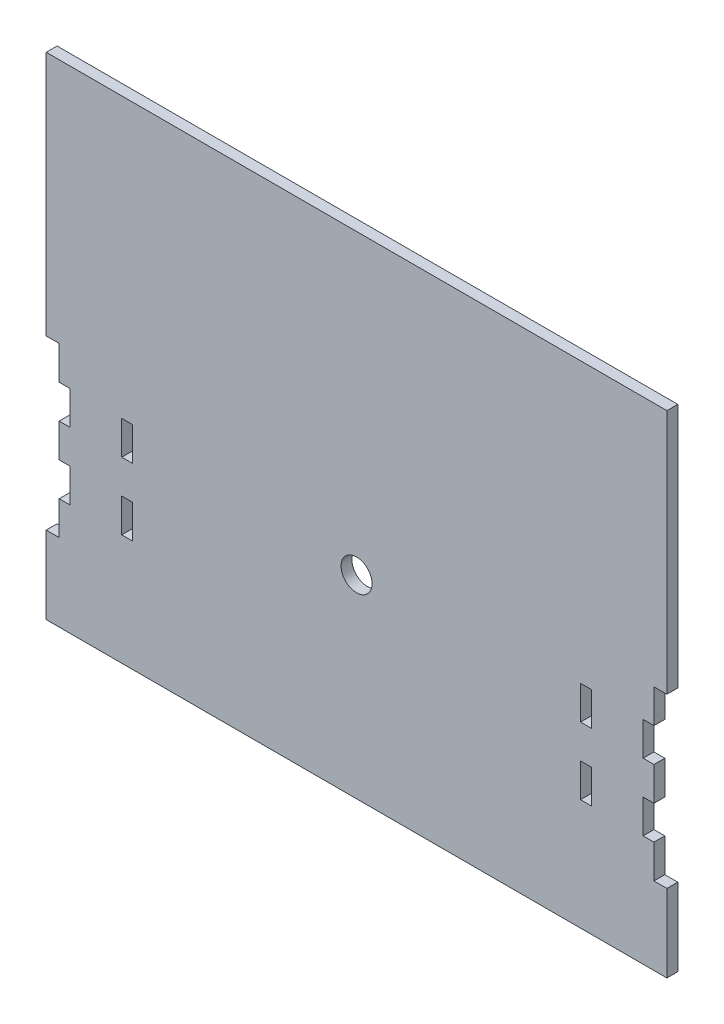
from build123d import *

# Parameters (mm, degrees)
SKETCH1_W           = 304.8
SKETCH1_H           = 241.3
BOSS_EXTRUDE1_DEPTH = 5.334
SKETCH2_W           = 6.35
SKETCH2_H           = 82.55
CUT_EXTRUDE1_DEPTH  = 195.44956687
SKETCH9_W           = 5.334
SKETCH9_H           = 16.51
CUT_EXTRUDE2_DEPTH  = 195.44956687
SKETCH23_W          = 5.334
SKETCH23_H          = 16.51
CUT_EXTRUDE8_DEPTH  = 195.44956687
SKETCH24_R          = 7.62
CUT_EXTRUDE9_DEPTH  = 195.44956687


with BuildPart() as part:
    # Sketch1 → Boss-Extrude1 (new body)
    with BuildSketch(Plane.XY):
        Rectangle(SKETCH1_W, SKETCH1_H)
    extrude(amount=BOSS_EXTRUDE1_DEPTH)

    # Sketch2 → Cut-Extrude1 (cut, through all)
    with BuildSketch(Plane(origin=(0, 0, 0), x_dir=(-1, 0, 0), z_dir=(0, 0, -1))):
        with Locations((149.225, -41.275)):
            Rectangle(SKETCH2_W, SKETCH2_H)
        with Locations((-149.225, -41.275)):
            Rectangle(SKETCH2_W, SKETCH2_H)
    extrude(amount=-CUT_EXTRUDE1_DEPTH, mode=Mode.SUBTRACT)

    # Sketch9 → Cut-Extrude2 (cut, through all)
    with BuildSketch(Plane.XY.offset(5.334)):
        with Locations((-143.383, -24.765)):
            Rectangle(SKETCH9_W, SKETCH9_H)
        with Locations((-143.383, -57.785)):
            Rectangle(SKETCH9_W, SKETCH9_H)
        with Locations((143.383, -57.785)):
            Rectangle(SKETCH9_W, SKETCH9_H)
        with Locations((143.383, -24.765)):
            Rectangle(SKETCH9_W, SKETCH9_H)
    extrude(amount=-CUT_EXTRUDE2_DEPTH, mode=Mode.SUBTRACT)

    # Sketch23 → Cut-Extrude8 (cut, through all)
    with BuildSketch(Plane.XY.offset(5.334)):
        with Locations((-112.649, -57.785)):
            Rectangle(SKETCH23_W, SKETCH23_H)
        with Locations((112.649, -24.765)):
            Rectangle(SKETCH23_W, SKETCH23_H)
        with Locations((112.649, -57.785)):
            Rectangle(SKETCH23_W, SKETCH23_H)
        with Locations((-112.649, -24.765)):
            Rectangle(SKETCH23_W, SKETCH23_H)
    extrude(amount=-CUT_EXTRUDE8_DEPTH, mode=Mode.SUBTRACT)

    # Sketch24 → Cut-Extrude9 (cut, through all)
    with BuildSketch(Plane(origin=(0, 0, 0), x_dir=(-1, 0, 0), z_dir=(0, 0, -1))):
        with Locations((0, -25.4)):
            Circle(SKETCH24_R)
    extrude(amount=-CUT_EXTRUDE9_DEPTH, mode=Mode.SUBTRACT)


solid = part.part
